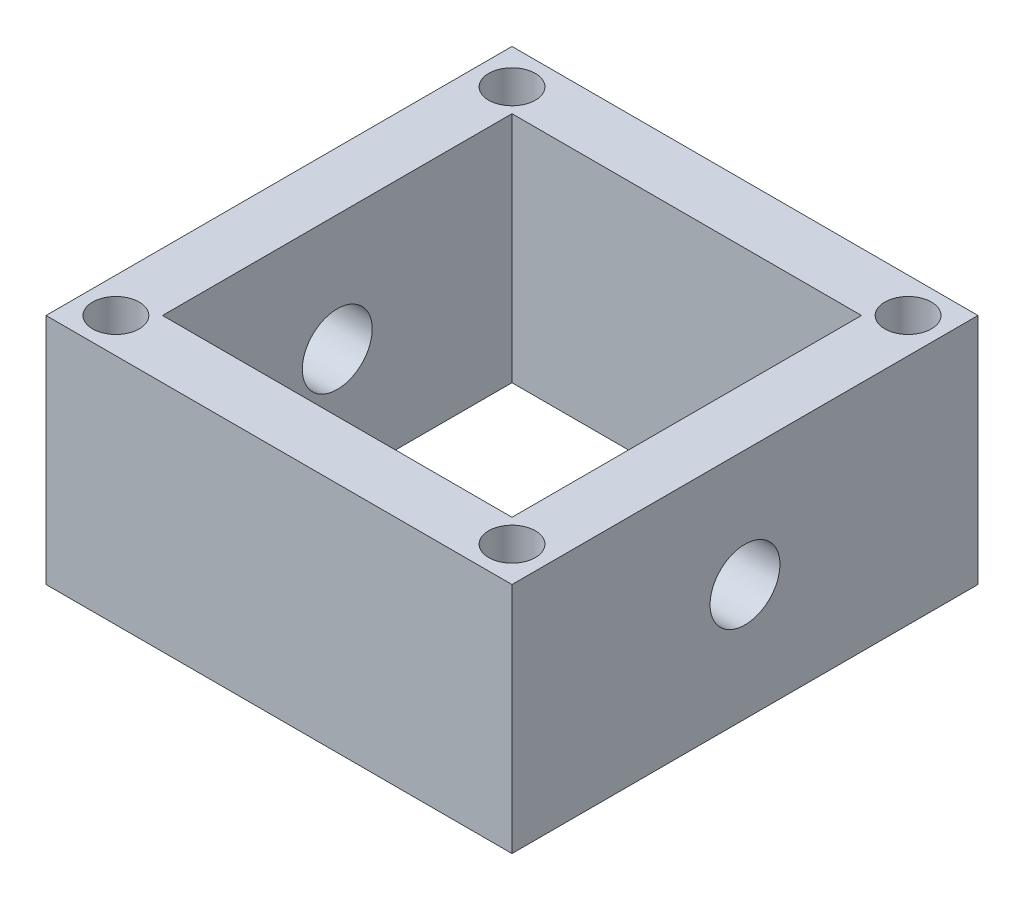
from build123d import *

# Parameters (mm, degrees)
SKETCH1_W           = 20
SKETCH1_H           = 20
SKETCH1_W_2         = 15
SKETCH1_H_2         = 15
BOSS_EXTRUDE1_DEPTH = 10
SKETCH2_R           = 1.5
CUT_EXTRUDE1_DEPTH  = 25.494897428
SKETCH3_R           = 1
CUT_EXTRUDE2_DEPTH  = 6


with BuildPart() as part:
    # Sketch1 → Boss-Extrude1 (new body)
    with BuildSketch(Plane(origin=(0, 0, 0), x_dir=(1, 0, 0), z_dir=(0, 1, 0))):
        Rectangle(SKETCH1_W, SKETCH1_H)
        Rectangle(SKETCH1_W_2, SKETCH1_H_2, mode=Mode.SUBTRACT)
    extrude(amount=BOSS_EXTRUDE1_DEPTH)

    # Sketch2 → Cut-Extrude1 (cut, through all)
    with BuildSketch(Plane.ZY.offset(10)):
        with Locations((0, 5)):
            Circle(SKETCH2_R)
    extrude(amount=-CUT_EXTRUDE1_DEPTH, mode=Mode.SUBTRACT)

    # Sketch3 → Cut-Extrude2 (cut)
    with BuildSketch(Plane(origin=(0, 10, 0), x_dir=(1, 0, 0), z_dir=(0, 1, 0))):
        with Locations((-8.5, 8.5)):
            Circle(SKETCH3_R)
        with Locations((8.5, 8.5)):
            Circle(SKETCH3_R)
        with Locations((8.5, -8.5)):
            Circle(SKETCH3_R)
        with Locations((-8.5, -8.5)):
            Circle(SKETCH3_R)
    extrude(amount=-CUT_EXTRUDE2_DEPTH, mode=Mode.SUBTRACT)


solid = part.part
